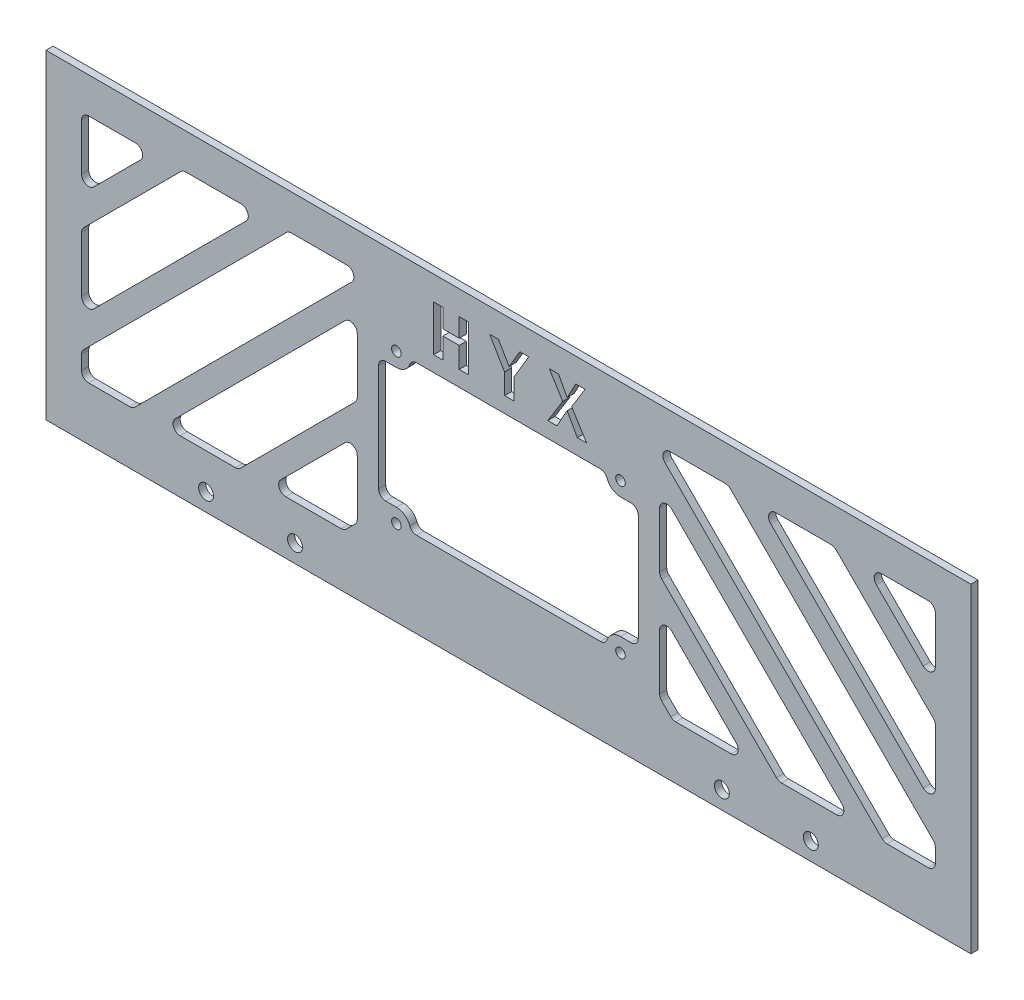
from build123d import *

# Parameters (mm, degrees)
SKETCH_1_W              = 260
SKETCH_1_H              = 90
EXTRUDE_1_DEPTH         = 2
HOLE_WIZARD_4_2_4_2_1_D = 4.2
HOLE_WIZARD_2_7_2_7_1_D = 2.7
CUT_EXTRUDE_1_DEPTH     = 2
SKETCH_7_W              = 5
SKETCH_7_H              = 34
CUT_EXTRUDE_2_DEPTH     = 138.582702401
CUT_EXTRUDE_3_DEPTH     = 138.582702401
FILLET_2_R              = 2
FILLET_2_OF_MIRROR_2_R  = 2
CUT_EXTRUDE_START       = -2
CUT_EXTRUDE_4_DEPTH     = 2
FILLET_4_R              = 2


# Read off the part's stored shape, not the designer's step: 切除-拉伸4
with BuildPart() as part:
    # 草图1 → 凸台-拉伸1 (new body)
    with BuildSketch(Plane.XY):
        Rectangle(SKETCH_1_W, SKETCH_1_H)
    extrude(amount=EXTRUDE_1_DEPTH)

    # Ø4.2 (4.2) 直径孔1 (through all)
    with Locations(Plane(origin=(-85, -40, 2), x_dir=(1, 0, 0), z_dir=(0, 0, 1))):
        with Locations((0, 0), (25, 0), (170, 0), (145, 0)):
            Hole(HOLE_WIZARD_4_2_4_2_1_D / 2)

    # Ø2.7 (2.7) 直径孔1 (through all)
    with Locations(Plane(origin=(-31.5, 21, 2), x_dir=(1, 0, 0), z_dir=(0, 0, 1))):
        with Locations((0, 0), (0, -42)):
            hole_wizard_2_7_2_7_1 = Hole(HOLE_WIZARD_2_7_2_7_1_D / 2)

    # 镜向1: Ø2.7 (2.7) 直径孔1 across plane
    add(hole_wizard_2_7_2_7_1.mirror(Plane(origin=(0, 0, 0), x_dir=(0, 0, 1), z_dir=(1, 0, 0))), mode=Mode.SUBTRACT)

    # 草图6 → 切除-拉伸1 (cut)
    with BuildSketch(Plane.XY.offset(2)):
        with BuildLine():
            Line((-27.5, 21), (27.5, 21))
            ThreePointArc((27.5, 21), (28.671572875, 18.171572875), (31.5, 17))
            Line((31.5, 17), (31.5, -17))
            ThreePointArc((31.5, -17), (28.671572875, -18.171572875), (27.5, -21))
            Line((27.5, -21), (-27.5, -21))
            ThreePointArc((-27.5, -21), (-28.671572875, -18.171572875), (-31.5, -17))
            Line((-31.5, -17), (-31.5, 17))
            ThreePointArc((-31.5, 17), (-28.671572875, 18.171572875), (-27.5, 21))
        make_face()
    extrude(amount=-CUT_EXTRUDE_1_DEPTH, mode=Mode.SUBTRACT)

    # 草图7 → 切除-拉伸2 (cut, through all)
    with BuildSketch(Plane.XY.offset(2)):
        with Locations((-34, 0)):
            Rectangle(SKETCH_7_W, SKETCH_7_H)
    cut_extrude_2 = extrude(amount=-CUT_EXTRUDE_2_DEPTH, mode=Mode.SUBTRACT)

    # 草图8 → 切除-拉伸3 (cut, through all)
    with BuildSketch(Plane.XY.offset(2)):
        Polygon((-120, 35), (-120, 15), (-100, 35), align=None)
        Polygon((-91.514718626, 35), (-120, 6.514718626), (-120, -14.69848481), (-70.30151519, 35), align=None)
        Polygon((-61.816233816, 35), (-120, -23.183766184), (-120, -30), (-105.60303038, -30), (-40.60303038, 35), align=None)
        Polygon((-42.5, 24.617749006), (-97.117749006, -30), (-75.90454557, -30), (-42.5, 3.40454557), align=None)
        Polygon((-42.5, -26.293939239), (-42.5, -5.080735804), (-67.419264196, -30), (-46.206060761, -30), align=None)
    cut_extrude_3 = extrude(amount=-CUT_EXTRUDE_3_DEPTH, mode=Mode.SUBTRACT)

    # 圆角2
    fillet_2_edges = [part.edges().sort_by_distance(p)[0] for p in [
        (-120, -14.69848481, 1),
        (-120, 6.514718626, 1),
        (-91.514718626, 35, 1),
        (-70.30151519, 35, 1),
        (-120, -30, 1),
        (-120, -23.183766184, 1),
        (-61.816233816, 35, 1),
        (-40.60303038, 35, 1),
        (-105.60303038, -30, 1),
        (-42.5, -26.293939239, 1),
        (-46.206060761, -30, 1),
        (-67.419264196, -30, 1),
        (-42.5, -5.080735804, 1),
        (-42.5, 24.617749006, 1),
        (-42.5, 3.40454557, 1),
        (-75.90454557, -30, 1),
        (-97.117749006, -30, 1),
        (-120, 35, 1),
        (-100, 35, 1),
        (-120, 15, 1),
    ]]
    fillet(fillet_2_edges, radius=FILLET_2_R)

    # 镜向2: 切除-拉伸3 across plane
    add(cut_extrude_3.mirror(Plane(origin=(0, 0, 0), x_dir=(0, 0, 1), z_dir=(1, 0, 0))), mode=Mode.SUBTRACT)

    # 圆角2 of 镜向2
    fillet_2_of_mirror_2_edges = [part.edges().sort_by_distance(p)[0] for p in [
        (120, -14.69848481, 1),
        (120, 6.514718626, 1),
        (91.514718626, 35, 1),
        (70.30151519, 35, 1),
        (120, -30, 1),
        (120, -23.183766184, 1),
        (61.816233816, 35, 1),
        (40.60303038, 35, 1),
        (105.60303038, -30, 1),
        (42.5, -26.293939239, 1),
        (46.206060761, -30, 1),
        (67.419264196, -30, 1),
        (42.5, -5.080735804, 1),
        (42.5, 24.617749006, 1),
        (42.5, 3.40454557, 1),
        (75.90454557, -30, 1),
        (97.117749006, -30, 1),
        (120, 35, 1),
        (100, 35, 1),
        (120, 15, 1),
    ]]
    fillet(fillet_2_of_mirror_2_edges, radius=FILLET_2_OF_MIRROR_2_R)

    # 切除-拉伸4 outline → 切除-拉伸4 (cut)
    with BuildSketch(Plane.XY.offset(2).offset(CUT_EXTRUDE_START)):
        Polygon((21.973641118, 25.366796339), (17.762377886, 32.115297406), (21.52686663, 38.215699679), (18.920682115, 38.215699679), (16.496516835, 33.68452385), (14.075109424, 38.215699679), (11.496503581, 38.215699679), (15.260992325, 32.118055274), (11.046971225, 25.366796339), (13.622819201, 25.366796339), (16.493758968, 30.482640017), (19.367456603, 25.366796339), align=None)
        Polygon((-1.083231919, 25.366796339), (1.506405393, 25.366796339), (1.506405393, 31.163833218), (5.720426492, 38.215699679), (3.202493728, 38.215699679), (0.197797401, 33.104809004), (-2.806898927, 38.215699679), (-5.297253019, 38.215699679), (-1.083231919, 31.116949476), align=None)
        Polygon((-13.842228788, 25.366796339), (-11.252591476, 25.366796339), (-11.252591476, 38.215699679), (-13.842228788, 38.215699679), (-13.842228788, 32.953689039), (-18.423046226, 32.953689039), (-18.423046226, 38.215699679), (-21.012683538, 38.215699679), (-21.012683538, 25.366796339), (-18.423046226, 25.366796339), (-18.423046226, 31.213474828), (-13.842228788, 31.213474828), align=None)
    extrude(amount=CUT_EXTRUDE_4_DEPTH, mode=Mode.SUBTRACT)

    # 镜向4: 切除-拉伸2 across plane
    add(cut_extrude_2.mirror(Plane(origin=(0, 0, 0), x_dir=(0, 0, 1), z_dir=(1, 0, 0))), mode=Mode.SUBTRACT)

    # 圆角4
    fillet_4_edges = [part.edges().sort_by_distance(p)[0] for p in [
        (36.5, 17, 1),
        (36.5, -17, 1),
        (-27.5, -21, 1),
        (-27.5, 21, 1),
        (27.5, 21, 1),
        (27.5, -21, 1),
        (-36.5, -17, 1),
        (-36.5, 17, 1),
    ]]
    fillet(fillet_4_edges, radius=FILLET_4_R)


solid = part.part
